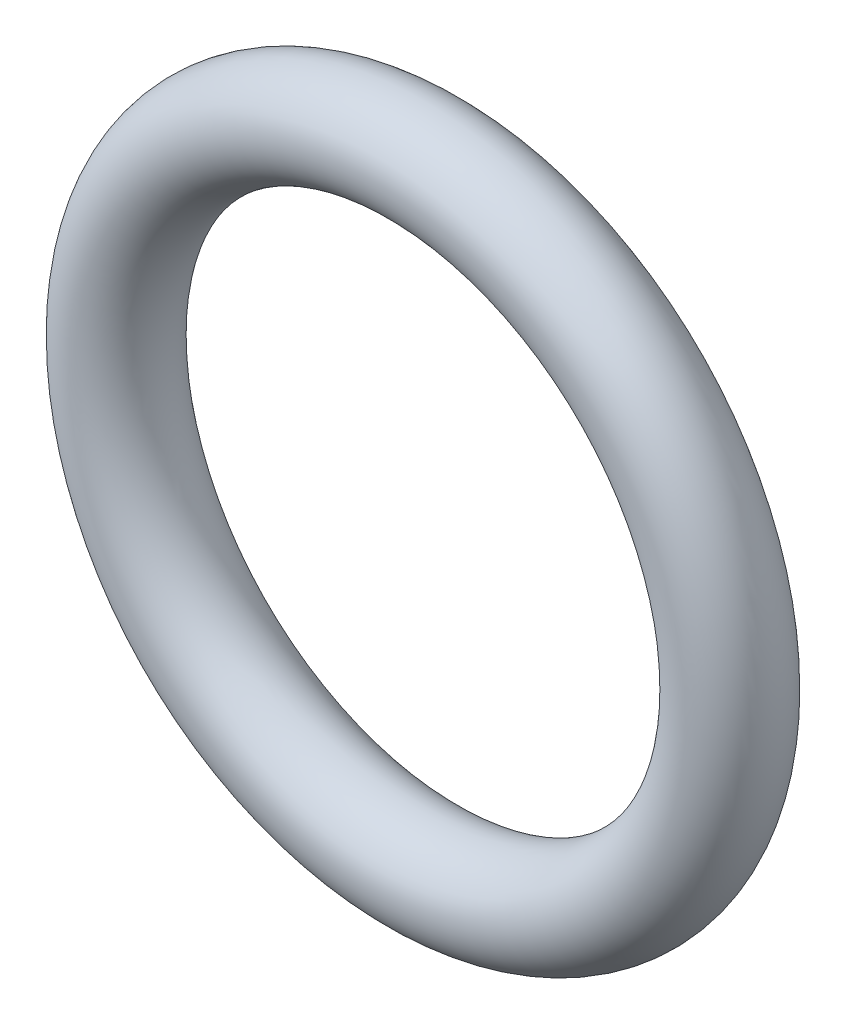
from build123d import *

# Parameters (mm, degrees)
SKETCH1_R = 0.889


with BuildPart() as part:
    # Sketch1 → Revolve1 (revolve)
    with BuildSketch(Plane(origin=(0, 0, 0), x_dir=(0, -1, 0), z_dir=(1, 0, 0))):
        with Locations((5.5118, 0)):
            Circle(SKETCH1_R)
    revolve(axis=Axis((0, 0, -0.9779), (0, 0, 1)))


solid = part.part
